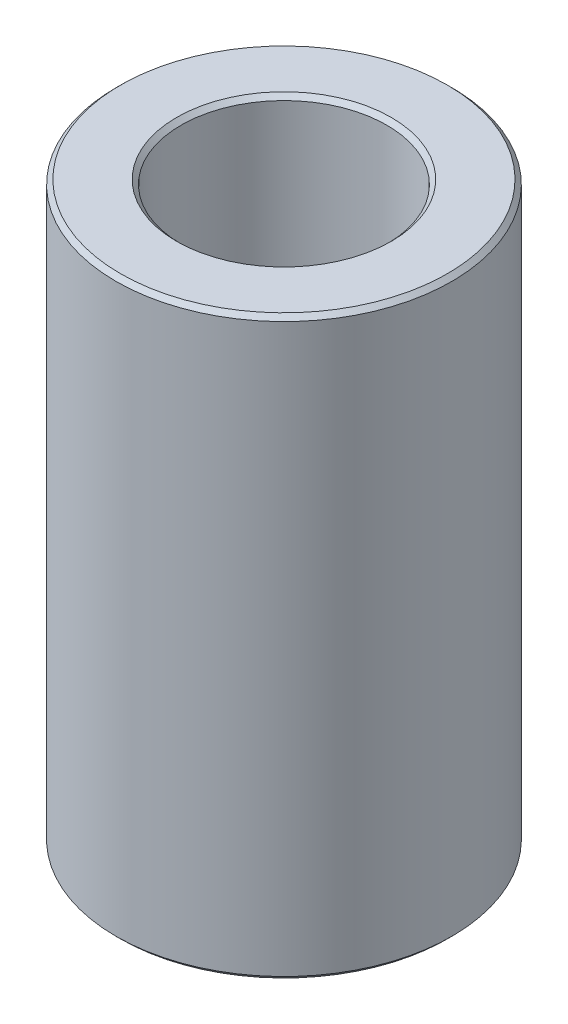
from build123d import *

# Parameters (mm, degrees)
SKETCH1_R           = 42.5
BOSS_EXTRUDE1_DEPTH = 145.853794204
SKETCH2_R           = 26.050988873
CUT_EXTRUDE1_DEPTH  = 158.752430358
CHAMFER1_SIZE       = 1.129297431


with BuildPart() as part:
    # Sketch1 → Boss-Extrude1 (new body)
    with BuildSketch(Plane(origin=(0, 0, 0), x_dir=(1, 0, 0), z_dir=(0, 1, 0))):
        Circle(SKETCH1_R)
    extrude(amount=BOSS_EXTRUDE1_DEPTH)

    # Sketch2 → Cut-Extrude1 (cut, through all)
    with BuildSketch(Plane(origin=(0, 0, 0), x_dir=(1, 0, 0), z_dir=(0, 1, 0))):
        Circle(SKETCH2_R)
    extrude(amount=CUT_EXTRUDE1_DEPTH, mode=Mode.SUBTRACT)

    # Chamfer1
    chamfer1_edges = [part.edges().sort_by_distance(p)[0] for p in [
        (-26.050988873, 145.853794204, 0),
        (-26.050988873, 0, 0),
        (-42.5, 0, 0),
        (-42.5, 145.853794204, 0),
    ]]
    chamfer(chamfer1_edges, length=CHAMFER1_SIZE)


solid = part.part
